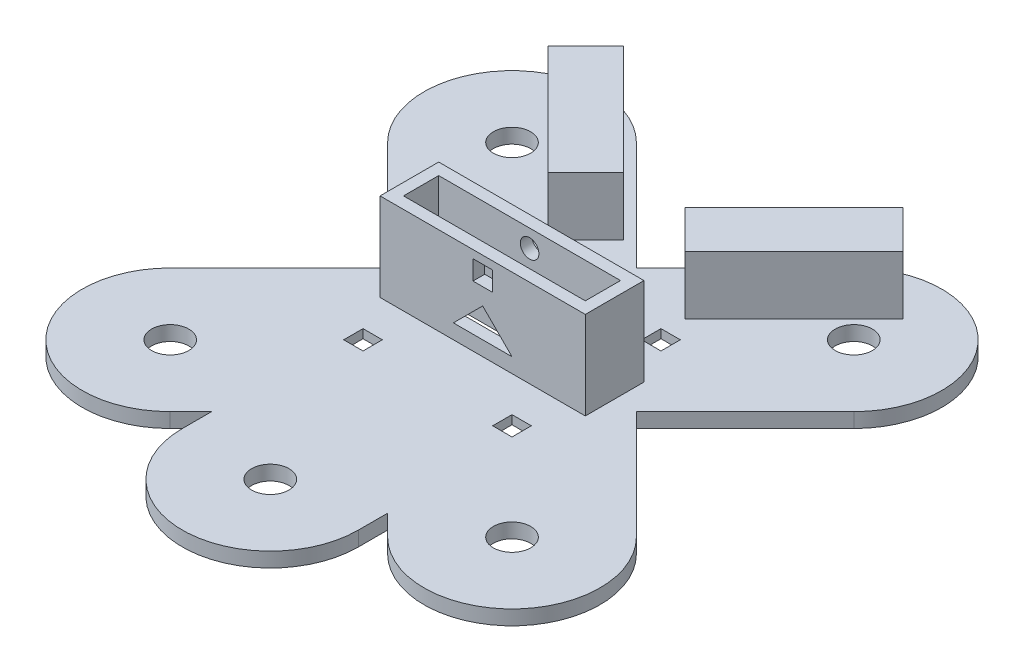
from build123d import *

# Parameters (mm, degrees)
BOSS_EXTRU_1_DEPTH      = 5
ENL_V_MAT_EXTRU_1_DEPTH = 2
ESQUISSE7_R             = 6.35
ENL_V_MAT_EXTRU_3_DEPTH = 144.034294879
ESQUISSE10_R            = 3.175
ENL_V_MAT_EXTRU_4_DEPTH = 144.034294879
ESQUISSE11_W            = 6.6
ESQUISSE11_H            = 6.6
ENL_V_MAT_EXTRU_5_DEPTH = 3.5
BOSS_EXTRU_8_DEPTH      = 20
ESQUISSE18_W            = 70
ESQUISSE18_H            = 20
ESQUISSE18_W_2          = 62
ESQUISSE18_H_2          = 12
BOSS_EXTRU_9_DEPTH      = 30
ESQUISSE19_R            = 3.175
ENL_V_MAT_EXTRU_6_DEPTH = 140.679208812
ESQUISSE20_W            = 6.6
ESQUISSE20_H            = 6.6
ENL_V_MAT_EXTRU_7_DEPTH = 4
ESQUISSE21_W            = 40
ESQUISSE21_H            = 10
ENL_V_MAT_EXTRU_8_DEPTH = 147.060978744
ENL_V_MAT_EXTRU_9_DEPTH = 155.943014199


with BuildPart() as part:
    # Esquisse2 → Boss.-Extru.1 (new body)
    with BuildSketch(Plane(origin=(0, 0, 0), x_dir=(1, 0, 0), z_dir=(0, 1, 0))):
        with BuildLine():
            Line((-42.426406871, 0), (-79.497474683, -37.071067812))
            ThreePointArc((-79.497474683, -37.071067812), (-79.497474683, -79.497474683), (-37.071067812, -79.497474683))
            Line((-37.071067812, -79.497474683), (-30, -72.426406871))
            Line((-30, -72.426406871), (-30, -82.426406871))
            ThreePointArc((-30, -82.426406871), (0, -112.426406871), (30, -82.426406871))
            Line((30, -82.426406871), (30, -72.426406871))
            Line((30, -72.426406871), (37.071067812, -79.497474683))
            ThreePointArc((37.071067812, -79.497474683), (79.497474683, -79.497474683), (79.497474683, -37.071067812))
            Line((79.497474683, -37.071067812), (42.426406871, 0))
            Line((42.426406871, 0), (79.497474683, 37.071067812))
            ThreePointArc((79.497474683, 37.071067812), (79.497474683, 79.497474683), (37.071067812, 79.497474683))
            Line((37.071067812, 79.497474683), (0, 42.426406871))
            Line((0, 42.426406871), (-37.071067812, 79.497474683))
            ThreePointArc((-37.071067812, 79.497474683), (-79.497474683, 79.497474683), (-79.497474683, 37.071067812))
            Line((-79.497474683, 37.071067812), (-42.426406871, 0))
        make_face()
    extrude(amount=BOSS_EXTRU_1_DEPTH)

    # Esquisse4 → Enlèv. mat.-Extru.1 (cut)
    with BuildSketch(Plane(origin=(0, 0, 0), x_dir=(-1, 0, 0), z_dir=(0, -1, 0))):
        with BuildLine():
            Line((-7.639320225, -28.852523661), (-28.852523661, -7.639320225))
            Line((-28.852523661, -7.639320225), (-46.53019319, -25.316989755))
            ThreePointArc((-46.53019319, -25.316989755), (-33.535533906, -33.535533906), (-25.316989755, -46.53019319))
            Line((-25.316989755, -46.53019319), (-7.639320225, -28.852523661))
        make_face()
        with BuildLine():
            ThreePointArc((-25.316989755, 46.53019319), (-33.535533906, 33.535533906), (-46.53019319, 25.316989755))
            Line((-46.53019319, 25.316989755), (-28.852523661, 7.639320225))
            Line((-28.852523661, 7.639320225), (-7.639320225, 28.852523661))
            Line((-7.639320225, 28.852523661), (-25.316989755, 46.53019319))
        make_face()
        with BuildLine():
            ThreePointArc((46.53019319, 25.316989755), (33.535533906, 33.535533906), (25.316989755, 46.53019319))
            Line((25.316989755, 46.53019319), (7.639320225, 28.852523661))
            Line((7.639320225, 28.852523661), (28.852523661, 7.639320225))
            Line((28.852523661, 7.639320225), (46.53019319, 25.316989755))
        make_face()
        with BuildLine():
            ThreePointArc((25.316989755, -46.53019319), (33.535533906, -33.535533906), (46.53019319, -25.316989755))
            Line((46.53019319, -25.316989755), (28.852523661, -7.639320225))
            Line((28.852523661, -7.639320225), (7.639320225, -28.852523661))
            Line((7.639320225, -28.852523661), (25.316989755, -46.53019319))
        make_face()
    extrude(amount=-ENL_V_MAT_EXTRU_1_DEPTH, mode=Mode.SUBTRACT)

    # Esquisse7 → Enlèv. mat.-Extru.3 (cut, through all)
    with BuildSketch(Plane(origin=(0, 0, 0), x_dir=(-1, 0, 0), z_dir=(0, -1, 0))):
        with Locations((0, -82.426406871)):
            Circle(ESQUISSE7_R)
        with Locations((-58.284271247, -58.284271247)):
            Circle(ESQUISSE7_R)
        with Locations((-58.284271247, 58.284271247)):
            Circle(ESQUISSE7_R)
        with Locations((58.284271247, 58.284271247)):
            Circle(ESQUISSE7_R)
        with Locations((58.284271247, -58.284271247)):
            Circle(ESQUISSE7_R)
    extrude(amount=-ENL_V_MAT_EXTRU_3_DEPTH, mode=Mode.SUBTRACT)

    # Esquisse10 → Enlèv. mat.-Extru.4 (cut, through all)
    with BuildSketch(Plane(origin=(0, 5, 0), x_dir=(1, 0, 0), z_dir=(0, 1, 0))):
        with Locations((25.403805922, -25.403805922)):
            Circle(ESQUISSE10_R)
        with Locations((-25.403805922, -25.403805922)):
            Circle(ESQUISSE10_R)
        with Locations((-25.403805922, 25.403805922)):
            Circle(ESQUISSE10_R)
        with Locations((25.403805922, 25.403805922)):
            Circle(ESQUISSE10_R)
    extrude(amount=-ENL_V_MAT_EXTRU_4_DEPTH, mode=Mode.SUBTRACT)

    # Esquisse11 → Enlèv. mat.-Extru.5 (cut)
    with BuildSketch(Plane(origin=(0, 5, 0), x_dir=(1, 0, 0), z_dir=(0, 1, 0))):
        with Locations((-25.403805922, -25.403805922)):
            Rectangle(ESQUISSE11_W, ESQUISSE11_H)
        with Locations((25.403805922, -25.403805922)):
            Rectangle(ESQUISSE11_W, ESQUISSE11_H)
        with Locations((-25.403805922, 25.403805922)):
            Rectangle(ESQUISSE11_W, ESQUISSE11_H)
        with Locations((25.403805922, 25.403805922)):
            Rectangle(ESQUISSE11_W, ESQUISSE11_H)
    extrude(amount=-ENL_V_MAT_EXTRU_5_DEPTH, mode=Mode.SUBTRACT)

    # Esquisse16 → Boss.-Extru.8 (add)
    with BuildSketch(Plane(origin=(0, 5, 0), x_dir=(1, 0, 0), z_dir=(0, 1, 0))):
        Polygon((47.702116935, 85.698237446), (10.478031818, 48.474152329), (23.340408221, 35.611775926), (60.564493338, 72.835861043), align=None)
        Polygon((-23.340408221, 35.611775926), (-60.564493338, 72.835861043), (-47.702116935, 85.698237446), (-10.478031818, 48.474152329), align=None)
    extrude(amount=BOSS_EXTRU_8_DEPTH)

    # Esquisse18 → Boss.-Extru.9 (add)
    with BuildSketch(Plane(origin=(0, 5, 0), x_dir=(1, 0, 0), z_dir=(0, 1, 0))):
        Rectangle(ESQUISSE18_W, ESQUISSE18_H)
        Rectangle(ESQUISSE18_W_2, ESQUISSE18_H_2, mode=Mode.SUBTRACT)
    extrude(amount=BOSS_EXTRU_9_DEPTH)

    # Esquisse19 → Enlèv. mat.-Extru.6 (cut, through all)
    with BuildSketch(Plane.XY.offset(10)):
        with Locations((0, 29)):
            Circle(ESQUISSE19_R)
    extrude(amount=-ENL_V_MAT_EXTRU_6_DEPTH, mode=Mode.SUBTRACT)

    # Esquisse20 → Enlèv. mat.-Extru.7 (cut)
    with BuildSketch(Plane.XY.offset(10)):
        with Locations((0, 29)):
            Rectangle(ESQUISSE20_W, ESQUISSE20_H)
    extrude(amount=-ENL_V_MAT_EXTRU_7_DEPTH, mode=Mode.SUBTRACT)

    # Esquisse21 → Enlèv. mat.-Extru.8 (cut, through all)
    with BuildSketch(Plane(origin=(0, 5, 0), x_dir=(1, 0, 0), z_dir=(0, 1, 0))):
        Rectangle(ESQUISSE21_W, ESQUISSE21_H)
    extrude(amount=-ENL_V_MAT_EXTRU_8_DEPTH, mode=Mode.SUBTRACT)

    # Esquisse22 → Enlèv. mat.-Extru.9 (cut, through all)
    with BuildSketch(Plane(origin=(0, 0, -10), x_dir=(-1, 0, 0), z_dir=(0, 0, -1))):
        Polygon((-10, 10), (10, 10), (0, 20), align=None)
    extrude(amount=-ENL_V_MAT_EXTRU_9_DEPTH, mode=Mode.SUBTRACT)


solid = part.part
